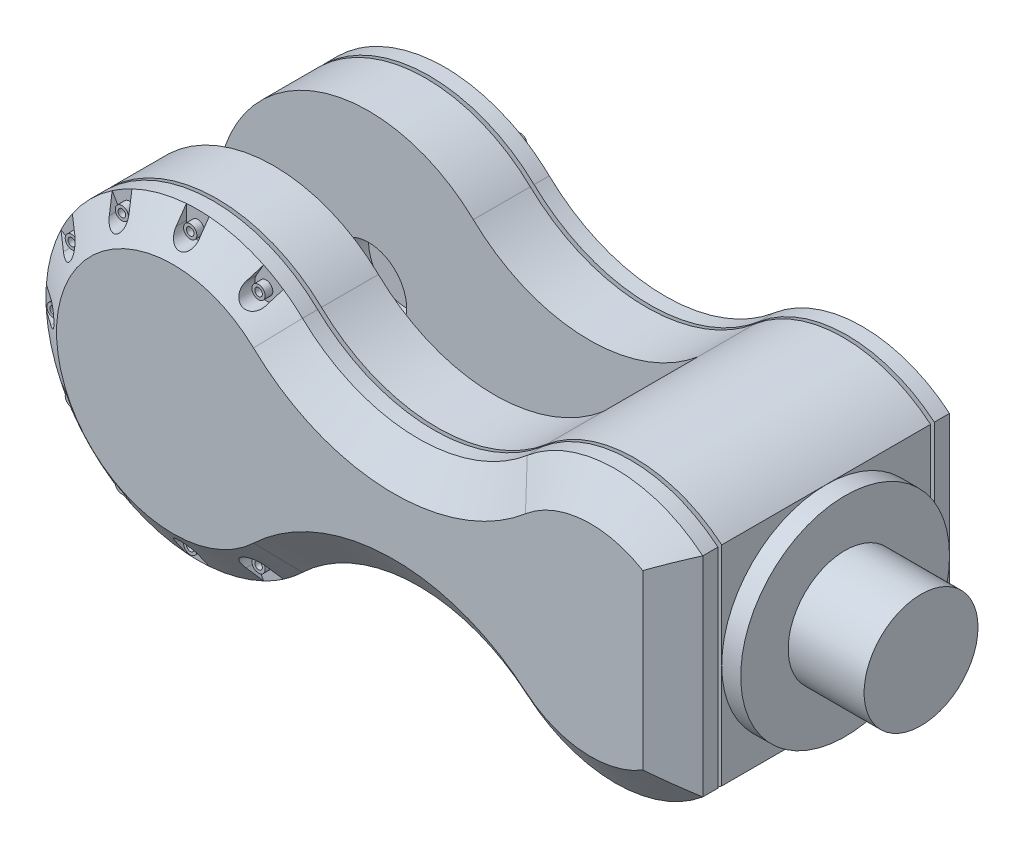
from build123d import *

# Parameters (mm, degrees)
SKETCH1_R           = 27.5
BOSS_EXTRUDE1_DEPTH = 5
BOSS_EXTRUDE2_DEPTH = 15
BOSS_EXTRUDE3_DEPTH = 1
BOSS_EXTRUDE5_START = 4
BOSS_EXTRUDE5_DEPTH = 4
BOSS_EXTRUDE6_DEPTH = 6.5
BOSS_EXTRUDE6_DRAFT = 55
CUT_EXTRUDE1_DEPTH  = 6.5
SKETCH9_R           = 1.75
SKETCH9_R_2         = 1
BOSS_EXTRUDE7_DEPTH = 2
CIRPATTERN1_COUNT   = 12
BOSS_EXTRUDE8_DEPTH = 40
SKETCH11_R          = 10
CUT_EXTRUDE2_DEPTH  = 10
SKETCH12_R          = 15
BOSS_EXTRUDE9_DEPTH = 20


# Read off the part's stored shape, not the designer's step: Mirror1
with BuildPart() as part:
    # Sketch1 → Boss-Extrude1 (new body)
    with BuildSketch(Plane(origin=(0, 0, 0), x_dir=(0, 0, -1), z_dir=(1, 0, 0))):
        Circle(SKETCH1_R)
    extrude(amount=BOSS_EXTRUDE1_DEPTH)

    # Sketch2 → Boss-Extrude2 (add)
    with BuildSketch(Plane.XY.offset(-27.5)):
        with BuildLine():
            Line((0, 27.5), (0, -27.5))
            ThreePointArc((0, -27.5), (-23.141445378, -35.850104508), (-46.216281209, -27.317655222))
            ThreePointArc((-46.216281209, -27.317655222), (-76.140798171, -16.793445233), (-105.428082883, -28.979119836))
            ThreePointArc((-105.428082883, -28.979119836), (-173, 0), (-105.428082883, 28.979119836))
            ThreePointArc((-105.428082883, 28.979119836), (-76.140798171, 16.793445233), (-46.216281209, 27.317655222))
            ThreePointArc((-46.216281209, 27.317655222), (-23.141445378, 35.850104508), (0, 27.5))
        make_face()
    extrude(amount=BOSS_EXTRUDE2_DEPTH)

    # Sketch4 → Boss-Extrude3 (add)
    with BuildSketch(Plane(origin=(0, 0, -27.5), x_dir=(-1, 0, 0), z_dir=(0, 0, -1))):
        with BuildLine():
            ThreePointArc((44.597310998, 25.412678725), (76.210919789, 14.294428834), (107.151327702, 27.167924846))
            ThreePointArc((107.151327702, 27.167924846), (170.5, 0), (107.151327702, -27.167924846))
            ThreePointArc((107.151327702, -27.167924846), (76.210919789, -14.294428834), (44.597310998, -25.412678725))
            ThreePointArc((44.597310998, -25.412678725), (23.707435126, -33.342879567), (2.5, -26.305856426))
            Line((2.5, -26.305856426), (2.5, 0))
            Line((2.5, 0), (2.5, 26.305856426))
            ThreePointArc((2.5, 26.305856426), (23.707435126, 33.342879567), (44.597310998, 25.412678725))
        make_face()
    extrude(amount=BOSS_EXTRUDE3_DEPTH)

    # Sketch6 → Boss-Extrude5 (add)
    with BuildSketch(Plane(origin=(0, 0, -28.5), x_dir=(-1, 0, 0), z_dir=(0, 0, -1)).offset(BOSS_EXTRUDE5_START)):
        with BuildLine():
            Line((0, 27.5), (0, 0))
            Line((0, 0), (0, -27.5))
            ThreePointArc((0, -27.5), (23.141445378, -35.850104508), (46.216281209, -27.317655222))
            ThreePointArc((46.216281209, -27.317655222), (76.140798171, -16.793445233), (105.428082883, -28.979119836))
            ThreePointArc((105.428082883, -28.979119836), (173, 0), (105.428082883, 28.979119836))
            ThreePointArc((105.428082883, 28.979119836), (76.140798171, 16.793445233), (46.216281209, 27.317655222))
            ThreePointArc((46.216281209, 27.317655222), (23.141445378, 35.850104508), (0, 27.5))
        make_face()
    extrude(amount=-BOSS_EXTRUDE5_DEPTH)


with BuildPart() as boss_extrude6_tool:
    # Sketch7 → Boss-Extrude6 (with draft: the straight prism first)
    with BuildSketch(Plane(origin=(0, 0, -32.5), x_dir=(-1, 0, 0), z_dir=(0, 0, -1))):
        with BuildLine():
            Line((0, 27.5), (0, -27.5))
            ThreePointArc((0, -27.5), (23.141445378, -35.850104508), (46.216281209, -27.317655222))
            ThreePointArc((46.216281209, -27.317655222), (76.140798171, -16.793445233), (105.428082883, -28.979119836))
            ThreePointArc((105.428082883, -28.979119836), (173, 0), (105.428082883, 28.979119836))
            ThreePointArc((105.428082883, 28.979119836), (76.140798171, 16.793445233), (46.216281209, 27.317655222))
            ThreePointArc((46.216281209, 27.317655222), (23.141445378, 35.850104508), (0, 27.5))
        make_face()
    extrude(amount=BOSS_EXTRUDE6_DEPTH)
    # Boss-Extrude6: the draft: its side faces are tilted about the plane it starts from
    boss_extrude6_sides = [boss_extrude6_tool.faces().sort_by_distance(p)[0] for p in [
        (0, 0, -35.75),
        (-23.141445378, -35.850104508, -35.75),
        (-76.140798171, -16.793445233, -35.75),
        (-173, 0, -35.75),
        (-76.140798171, 16.793445233, -35.75),
        (-23.141445378, 35.850104508, -35.75),
    ]]
    draft(boss_extrude6_sides, Plane(origin=(0, 0, -32.5), x_dir=(-1, 0, 0), z_dir=(0, 0, -1)), BOSS_EXTRUDE6_DRAFT)


with BuildPart() as part_1:
    add(part.part)

    # Boss-Extrude6: add boss_extrude6_tool
    add(boss_extrude6_tool.part)

    # Sketch8 → Cut-Extrude1 (cut)
    with BuildSketch(Plane(origin=(0, 0, -39), x_dir=(-1, 0, 0), z_dir=(0, 0, -1))):
        with BuildLine():
            Line((169, 3), (176.139484987, 3))
            Line((176.139484987, 3), (176.139484987, -3))
            Line((176.139484987, -3), (169, -3))
            ThreePointArc((169, -3), (166, 0), (169, 3))
        make_face()
    cut_extrude1 = extrude(amount=-CUT_EXTRUDE1_DEPTH, mode=Mode.SUBTRACT)

    # Sketch9 → Boss-Extrude7 (add)
    with BuildSketch(Plane(origin=(0, 0, -32.5), x_dir=(-1, 0, 0), z_dir=(0, 0, -1))):
        with Locations((169, 0)):
            Circle(SKETCH9_R)
        with Locations((169, 0)):
            Circle(SKETCH9_R_2, mode=Mode.SUBTRACT)
    boss_extrude7 = extrude(amount=BOSS_EXTRUDE7_DEPTH)

    # CirPattern1: Cut-Extrude1, Boss-Extrude7 ×12 about axis, 3 skipped
    cirpattern1_axis = Axis((-133, 0, 0), (0, 0, -1))
    add([cut_extrude1.rotate(cirpattern1_axis, i * 360 / CIRPATTERN1_COUNT) for i in range(1, CIRPATTERN1_COUNT) if i not in (5, 6, 7)], mode=Mode.SUBTRACT)
    add([boss_extrude7.rotate(cirpattern1_axis, i * 360 / CIRPATTERN1_COUNT) for i in range(1, CIRPATTERN1_COUNT) if i not in (5, 6, 7)])

    # Sketch10 → Boss-Extrude8 (add)
    with BuildSketch(Plane.XY.offset(-12.5)):
        with BuildLine():
            Line((-46.216281209, 27.317655222), (-46.216281209, -27.317655222))
            ThreePointArc((-46.216281209, -27.317655222), (-23.141445378, -35.850104508), (0, -27.5))
            Line((0, -27.5), (0, -24.494897428))
            Line((0, -24.494897428), (0, 24.494897428))
            Line((0, 24.494897428), (0, 27.5))
            ThreePointArc((0, 27.5), (-23.141445378, 35.850104508), (-46.216281209, 27.317655222))
        make_face()
    extrude(amount=BOSS_EXTRUDE8_DEPTH)

    # Sketch11 → Cut-Extrude2 (cut)
    with BuildSketch(Plane.XY.offset(-12.5)):
        with Locations((-133, 0)):
            Circle(SKETCH11_R)
    extrude(amount=-CUT_EXTRUDE2_DEPTH, mode=Mode.SUBTRACT)

    # Mirror1: part across plane


with BuildPart() as part_2:
    add(part_1.part)
    add(part_1.part.mirror(Plane.XY))

    # Sketch12 → Boss-Extrude9 (add)
    with BuildSketch(Plane(origin=(5, 0, 0), x_dir=(0, 0, -1), z_dir=(1, 0, 0))):
        Circle(SKETCH12_R)
    extrude(amount=BOSS_EXTRUDE9_DEPTH)


solid = part_2.part
